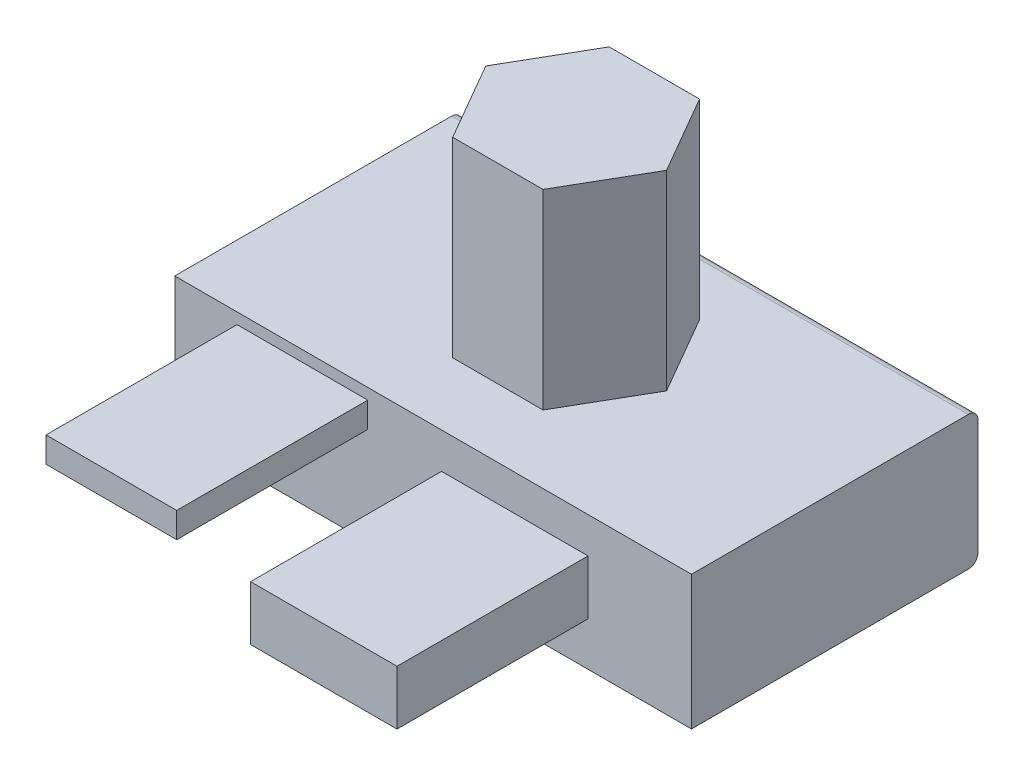
from build123d import *

# Parameters (mm, degrees)
SKETCH1_W           = 137.407001984
SKETCH1_H           = 35.641957088
BOSS_EXTRUDE1_DEPTH = 76.2
BOSS_EXTRUDE2_DEPTH = 50.8
SKETCH4_W           = 34.762618313
SKETCH4_H           = 6.759398006
SKETCH4_W_2         = 38.947007555
SKETCH4_H_2         = 14.484424297
BOSS_EXTRUDE4_DEPTH = 50.8
FILLET2_R           = 2.54


with BuildPart() as part:
    # Sketch1 → Boss-Extrude1 (new body)
    with BuildSketch(Plane.XY):
        Rectangle(SKETCH1_W, SKETCH1_H)
    extrude(amount=BOSS_EXTRUDE1_DEPTH)

    # Sketch2 → Boss-Extrude2 (add)
    with BuildSketch(Plane(origin=(0, 17.820978544, 0), x_dir=(1, 0, 0), z_dir=(0, 1, 0))):
        Polygon((23.159003861, -37.290679973), (11.143714224, -16.479587852), (-12.886865052, -16.479587852), (-24.90215469, -37.290679973), (-12.886865052, -58.101772093), (11.143714224, -58.101772093), align=None)
    extrude(amount=BOSS_EXTRUDE2_DEPTH)

    # Sketch4 → Boss-Extrude4 (add)
    with BuildSketch(Plane.XY.offset(76.2)):
        with Locations((-34.762618313, 11.507070414)):
            Rectangle(SKETCH4_W, SKETCH4_H)
        with Locations((21.726636446, 1.04609731)):
            Rectangle(SKETCH4_W_2, SKETCH4_H_2)
    extrude(amount=BOSS_EXTRUDE4_DEPTH)

    # Fillet2
    fillet2_edges = [part.edges().sort_by_distance(p)[0] for p in [
        (0, -17.820978544, 0),
        (0, 17.820978544, 0),
    ]]
    fillet(fillet2_edges, radius=FILLET2_R)


solid = part.part
